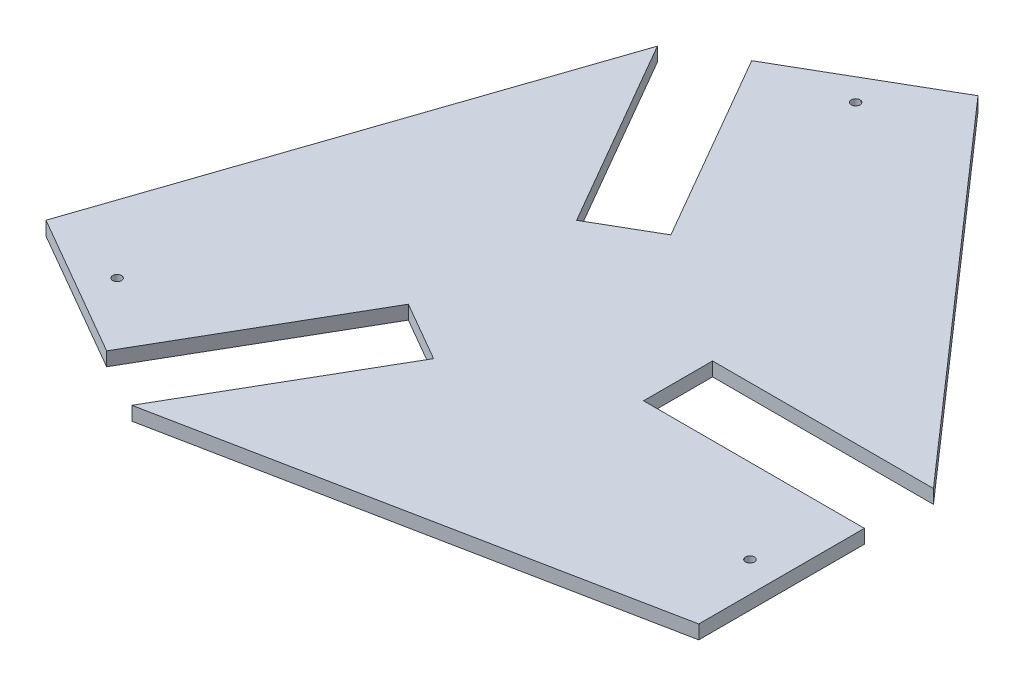
from build123d import *

# Parameters (mm, degrees)
SKETCH1_R           = 1.016
BOSS_EXTRUDE2_DEPTH = 3.175


with BuildPart() as part:
    # Sketch1 → Boss-Extrude2 (new body)
    with BuildSketch(Plane(origin=(0, 0, 0), x_dir=(1, 0, 0), z_dir=(0, 1, 0))):
        Polygon((76.2, -47.5615), (-32.545746073, -69.197885768), (-7.145746073, -25.203795256), (-20.893899358, -17.266295256), (-46.293899358, -61.260385768), (-79.289467242, -42.210385768), (-43.654253927, 62.784385768), (-18.254253927, 18.790295256), (-4.506100642, 26.727795256), (-29.906100642, 70.721885768), (3.089467242, 89.771885768), (76.2, 6.4135), (25.4, 6.4135), (25.4, -9.4615), (76.2, -9.4615), align=None)
        with Locations((69.2404, -28.829)):
            Circle(SKETCH1_R, mode=Mode.SUBTRACT)
        with Locations((-59.586846366, -45.549445368)):
            Circle(SKETCH1_R, mode=Mode.SUBTRACT)
        with Locations((-9.653553634, 74.378445368)):
            Circle(SKETCH1_R, mode=Mode.SUBTRACT)
    extrude(amount=BOSS_EXTRUDE2_DEPTH)


solid = part.part
